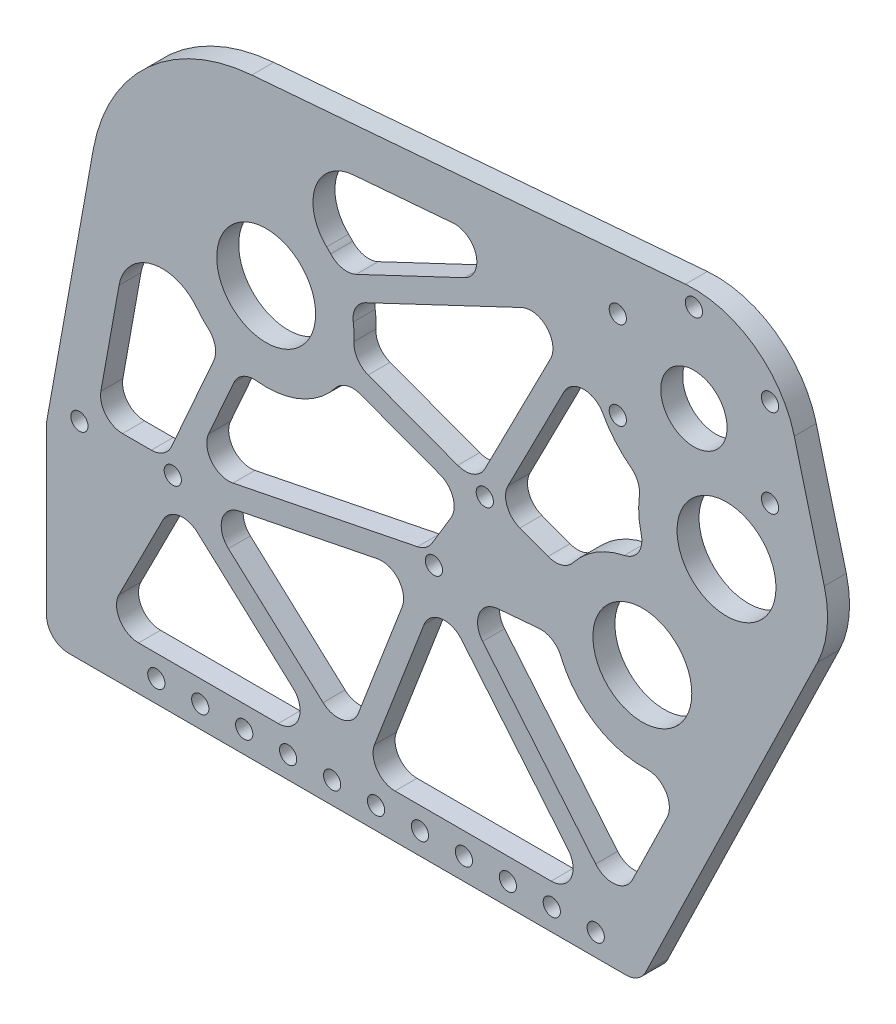
from build123d import *

# Parameters (mm, degrees)
BOSS_EXTRUDE1_DEPTH = 6.35
SKETCH8_R           = 2.4892
SKETCH8_R_2         = 9.5885
SKETCH8_R_3         = 14.2875
CUT_EXTRUDE1_DEPTH  = 423.42202378
FILLET2_R           = 6.35
CUT_EXTRUDE2_DEPTH  = 423.42202378
FILLET4_R           = 6.35


with BuildPart() as part:
    # Sketch6 → Boss-Extrude1 (new body)
    with BuildSketch(Plane.XY):
        with BuildLine():
            Line((88.9, 100.1522), (88.9, 154.686))
            Line((88.9, 154.686), (102.403069007, 229.723049032))
            ThreePointArc((102.403069007, 229.723049032), (118.243806289, 258.329117307), (148.236473073, 271.355092857))
            Line((148.236473073, 271.355092857), (273.564102719, 281.661518102))
            ThreePointArc((273.564102719, 281.661518102), (293.369579348, 276.238056201), (305.046216096, 259.346431124))
            Line((305.046216096, 259.346431124), (313.710213478, 226.178385499))
            ThreePointArc((313.710213478, 226.178385499), (314.518022723, 215.934709796), (311.728513814, 206.045114875))
            Line((311.728513814, 206.045114875), (260.35, 100.1522))
            Line((260.35, 100.1522), (88.9, 100.1522))
        make_face()
    extrude(amount=-BOSS_EXTRUDE1_DEPTH)

    # Sketch8 → Cut-Extrude1 (cut, through all)
    with BuildSketch(Plane.XY):
        with Locations((254.025620114, 239.06503877)):
            Circle(SKETCH8_R)
        with Locations((254.025620114, 264.46503877)):
            Circle(SKETCH8_R)
        with Locations((298.019710626, 264.46503877)):
            Circle(SKETCH8_R)
        with Locations((276.02266537, 251.76503877)):
            Circle(SKETCH8_R_2)
        with Locations((261.120439119, 180.086)):
            Circle(SKETCH8_R_3)
        with Locations((152.4, 220.726)):
            Circle(SKETCH8_R_3)
        with Locations((215.588385064, 199.44728721)):
            Circle(SKETCH8_R)
        with Locations((200.87775722, 174.949776042)):
            Circle(SKETCH8_R)
        with Locations((247.65, 106.5022)):
            Circle(SKETCH8_R)
        with Locations((234.95, 106.5022)):
            Circle(SKETCH8_R)
        with Locations((222.25, 106.5022)):
            Circle(SKETCH8_R)
        with Locations((209.55, 106.5022)):
            Circle(SKETCH8_R)
        with Locations((196.85, 106.5022)):
            Circle(SKETCH8_R)
        with Locations((184.15, 106.5022)):
            Circle(SKETCH8_R)
        with Locations((171.45, 106.5022)):
            Circle(SKETCH8_R)
        with Locations((158.75, 106.5022)):
            Circle(SKETCH8_R)
        with Locations((146.05, 106.5022)):
            Circle(SKETCH8_R)
        with Locations((133.35, 106.5022)):
            Circle(SKETCH8_R)
        with Locations((120.65, 106.5022)):
            Circle(SKETCH8_R)
        with Locations((98.425, 159.766)):
            Circle(SKETCH8_R)
        with Locations((125.4125, 159.766)):
            Circle(SKETCH8_R)
        with Locations((276.02266537, 277.16503877)):
            Circle(SKETCH8_R)
        with Locations((298.019710626, 239.06503877)):
            Circle(SKETCH8_R)
        with Locations((285.448500239, 218.795996669)):
            Circle(SKETCH8_R_3)
    extrude(amount=-CUT_EXTRUDE1_DEPTH, mode=Mode.SUBTRACT)

    # Fillet2
    fillet2_edges = [part.edges().sort_by_distance(p)[0] for p in [
        (260.35, 100.1522, -3.175),
        (88.9, 100.1522, -3.175),
        (88.9, 154.686, -3.175),
    ]]
    fillet(fillet2_edges, radius=FILLET2_R)

    # Sketch10 → Cut-Extrude2 (cut, through all)
    with BuildSketch(Plane.XY):
        with BuildLine():
            ThreePointArc((132.38135413, 205.092260283), (119.322526921, 209.603834109), (109.872798447, 199.524652682))
            Line((109.872798447, 199.524652682), (103.289496024, 162.941))
            Line((103.289496024, 162.941), (123.345875833, 162.941))
            Line((123.345875833, 162.941), (139.295192153, 198.967690982))
            ThreePointArc((139.295192153, 198.967690982), (135.557542228, 201.713067133), (132.38135413, 205.092260283))
        make_face()
        with BuildLine():
            Line((241.195198828, 266.256762477), (177.579878122, 261.025301952))
            ThreePointArc((177.579878122, 261.025301952), (166.641364906, 252.585148215), (169.880506569, 239.154019158))
            ThreePointArc((169.880506569, 239.154019158), (171.997015188, 236.885114942), (173.821083249, 234.375072952))
            Line((173.821083249, 234.375072952), (241.195198828, 266.256762477))
        make_face()
        with BuildLine():
            ThreePointArc((174.893810536, 208.928182933), (162.247952366, 197.312802136), (145.101630643, 196.397132276))
            Line((145.101630643, 196.397132276), (130.798217617, 164.08824638))
            Line((130.798217617, 164.08824638), (198.877387124, 177.785925299))
            Line((198.877387124, 177.785925299), (209.75334836, 195.89759155))
            Line((209.75334836, 195.89759155), (174.893810536, 208.928182933))
        make_face()
        with BuildLine():
            Line((243.097425101, 260.131834596), (176.537179334, 228.635271383))
            ThreePointArc((176.537179334, 228.635271383), (177.777461003, 221.79580047), (177.117199892, 214.876211158))
            Line((177.117199892, 214.876211158), (213.044976181, 201.446309291))
            Line((213.044976181, 201.446309291), (243.097425101, 260.131834596))
        make_face()
        with BuildLine():
            ThreePointArc((261.028629255, 225.783836185), (250.007197249, 236.830534251), (246.025658275, 251.91857087))
            Line((246.025658275, 251.91857087), (219.032938132, 199.207992598))
            Line((219.032938132, 199.207992598), (238.626628583, 191.883817067))
            ThreePointArc((238.626628583, 191.883817067), (249.192499835, 202.511081146), (263.910416147, 205.332307219))
            ThreePointArc((263.910416147, 205.332307219), (260.296966131, 215.251940798), (261.028629255, 225.783836185))
        make_face()
        Polygon((172.279016319, 112.8522), (126.358196435, 154.614319603), (105.160585646, 112.8522), align=None)
        Polygon((195.84095645, 170.6977325), (132.192607025, 157.891544345), (175.700474976, 118.323853924), align=None)
        Polygon((201.895478969, 168.750492641), (180.399676902, 112.8522), (248.270601841, 112.8522), align=None)
        with BuildLine():
            ThreePointArc((274.559934286, 158.532810685), (251.195777622, 156.705215279), (236.280473193, 174.781653407))
            Line((236.280473193, 174.781653407), (207.199645505, 172.302254429))
            Line((207.199645505, 172.302254429), (253.918362932, 115.989809807))
            Line((253.918362932, 115.989809807), (274.559934286, 158.532810685))
        make_face()
    extrude(amount=-CUT_EXTRUDE2_DEPTH, mode=Mode.SUBTRACT)

    # Fillet4
    fillet4_edges = [part.edges().sort_by_distance(p)[0] for p in [
        (248.270601841, 112.8522, -3.175),
        (180.399676902, 112.8522, -3.175),
        (201.895478969, 168.750492641, -3.175),
        (174.893810536, 208.928182933, -3.175),
        (209.75334836, 195.89759155, -3.175),
        (198.877387124, 177.785925299, -3.175),
        (130.798217617, 164.08824638, -3.175),
        (145.101630643, 196.397132276, -3.175),
        (241.195198828, 266.256762477, -3.175),
        (173.821083249, 234.375072952, -3.175),
        (176.537179334, 228.635271383, -3.175),
        (213.044976181, 201.446309291, -3.175),
        (177.117199892, 214.876211158, -3.175),
        (172.279016319, 112.8522, -3.175),
        (105.160585646, 112.8522, -3.175),
        (126.358196435, 154.614319603, -3.175),
        (263.910416147, 205.332307219, -3.175),
        (238.626628583, 191.883817067, -3.175),
        (219.032938132, 199.207992598, -3.175),
        (246.025658275, 251.91857087, -3.175),
        (261.028629255, 225.783836185, -3.175),
        (139.295192153, 198.967690982, -3.175),
        (123.345875833, 162.941, -3.175),
        (103.289496024, 162.941, -3.175),
        (195.84095645, 170.6977325, -3.175),
        (175.700474976, 118.323853924, -3.175),
        (132.192607025, 157.891544345, -3.175),
        (274.559934286, 158.532810685, -3.175),
        (253.918362932, 115.989809807, -3.175),
        (207.199645505, 172.302254429, -3.175),
        (236.280473193, 174.781653407, -3.175),
        (243.097425101, 260.131834596, -3.175),
    ]]
    fillet(fillet4_edges, radius=FILLET4_R)


solid = part.part
